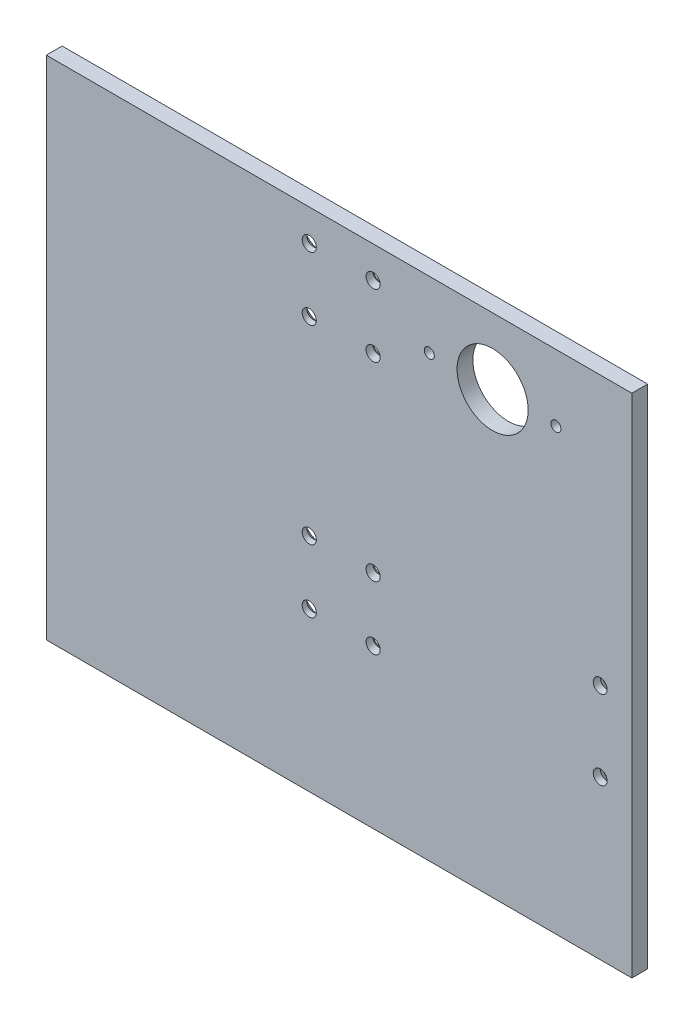
from build123d import *

# Parameters (mm, degrees)
SKETCH1_W                                          = 234.95
SKETCH1_H                                          = 203.2
BOSS_EXTRUDE1_DEPTH                                = 6.35
SKETCH2_R                                          = 14.2748
CUT_EXTRUDE1_DEPTH                                 = 156.445354144
CSK_FOR_10_FLAT_HEAD_MACHINE_SCREW_100_D           = 5.6134
CSK_FOR_10_FLAT_HEAD_MACHINE_SCREW_100_CSINK_D     = 17.78
CSK_FOR_10_FLAT_HEAD_MACHINE_SCREW_100_CSINK_ANGLE = 90
CSK_FOR_10_FLAT_HEAD_MACHINE_SCREW_2_D             = 5.6134
CSK_FOR_10_FLAT_HEAD_MACHINE_SCREW_2_CSINK_D       = 17.78
CSK_FOR_10_FLAT_HEAD_MACHINE_SCREW_2_CSINK_ANGLE   = 90
CSK_FOR_10_FLAT_HEAD_MACHINE_SCREW_3_D             = 5.6134
CSK_FOR_10_FLAT_HEAD_MACHINE_SCREW_3_DEPTH         = 24.315407369
CSK_FOR_10_FLAT_HEAD_MACHINE_SCREW_3_CSINK_D       = 12.7
CSK_FOR_10_FLAT_HEAD_MACHINE_SCREW_3_CSINK_ANGLE   = 90
CSK_FOR_10_FLAT_HEAD_MACHINE_SCREW_3_TIP           = 1.686435499
CUT_EXTRUDE2_DEPTH                                 = 156.445354144


with BuildPart() as part:
    # Sketch1 → Boss-Extrude1 (new body)
    with BuildSketch(Plane.XY):
        Rectangle(SKETCH1_W, SKETCH1_H)
    extrude(amount=BOSS_EXTRUDE1_DEPTH)

    # Sketch2 → Cut-Extrude1 (cut, through all)
    with BuildSketch(Plane.XY.offset(6.35)):
        with Locations((61.595, 74.93)):
            Circle(SKETCH2_R)
    extrude(amount=-CUT_EXTRUDE1_DEPTH, mode=Mode.SUBTRACT)

    # CSK for _10 Flat Head Machine Screw _100 (through all)
    with Locations(Plane(origin=(292.076985897, -265.595089466, -43.80037576), x_dir=(0.9908610866457157, 0, -0.1348862742137668), z_dir=(-0.1348862742137668, 0, -0.9908610866457157))):
        with Locations((-308.041854918, -227.495089466), (-308.041854918, -252.895089466), (-308.041972913, -329.095089466), (-308.041972913, -354.495089466)):
            CounterSinkHole(CSK_FOR_10_FLAT_HEAD_MACHINE_SCREW_100_D / 2, CSK_FOR_10_FLAT_HEAD_MACHINE_SCREW_100_CSINK_D / 2, counter_sink_angle=CSK_FOR_10_FLAT_HEAD_MACHINE_SCREW_100_CSINK_ANGLE)

    # CSK for _10 Flat Head Machine Screw  2 (through all)
    with Locations(Plane(origin=(292.419597033, -265.595089466, -41.283588599), x_dir=(0.9908610866457157, 0, -0.13488627421376656), z_dir=(-0.13488627421376656, 0, -0.9908610866457157))):
        with Locations((-282.641854918, -227.495089466), (-282.641854918, -252.895089466), (-282.641972913, -329.095089466), (-282.641972913, -354.495089466)):
            CounterSinkHole(CSK_FOR_10_FLAT_HEAD_MACHINE_SCREW_2_D / 2, CSK_FOR_10_FLAT_HEAD_MACHINE_SCREW_2_CSINK_D / 2, counter_sink_angle=CSK_FOR_10_FLAT_HEAD_MACHINE_SCREW_2_CSINK_ANGLE)

    # CSK for _10 Flat Head Machine Screw  3
    with Locations(Plane(origin=(-285.488101876, 60.95524491, 0), x_dir=(-1, 0, 0), z_dir=(0, 0, -1))):
        with Locations((-390.263101876, -67.30524491), (-390.263101876, -99.05524491)):
            CounterSinkHole(CSK_FOR_10_FLAT_HEAD_MACHINE_SCREW_3_D / 2, CSK_FOR_10_FLAT_HEAD_MACHINE_SCREW_3_CSINK_D / 2, depth=CSK_FOR_10_FLAT_HEAD_MACHINE_SCREW_3_DEPTH, counter_sink_angle=CSK_FOR_10_FLAT_HEAD_MACHINE_SCREW_3_CSINK_ANGLE)
            with Locations((0, 0, -(CSK_FOR_10_FLAT_HEAD_MACHINE_SCREW_3_DEPTH + CSK_FOR_10_FLAT_HEAD_MACHINE_SCREW_3_TIP / 2))):  # 118° drill point
                Cone(0, CSK_FOR_10_FLAT_HEAD_MACHINE_SCREW_3_D / 2, CSK_FOR_10_FLAT_HEAD_MACHINE_SCREW_3_TIP, mode=Mode.SUBTRACT)

    # Sketch10 → Cut-Extrude2 (cut, through all)
    with BuildSketch(Plane(origin=(0, 0, 0), x_dir=(-1, 0, 0), z_dir=(0, 0, -1))):
        with BuildLine():
            ThreePointArc((-86.995, 76.9493), (-89.0143, 74.93), (-86.995, 72.9107))
            ThreePointArc((-86.995, 72.9107), (-84.9757, 74.93), (-86.995, 76.9493))
        make_face()
        with BuildLine():
            ThreePointArc((-36.195, 76.9493), (-38.2143, 74.93), (-36.195, 72.9107))
            ThreePointArc((-36.195, 72.9107), (-34.1757, 74.93), (-36.195, 76.9493))
        make_face()
    extrude(amount=-CUT_EXTRUDE2_DEPTH, mode=Mode.SUBTRACT)


solid = part.part
